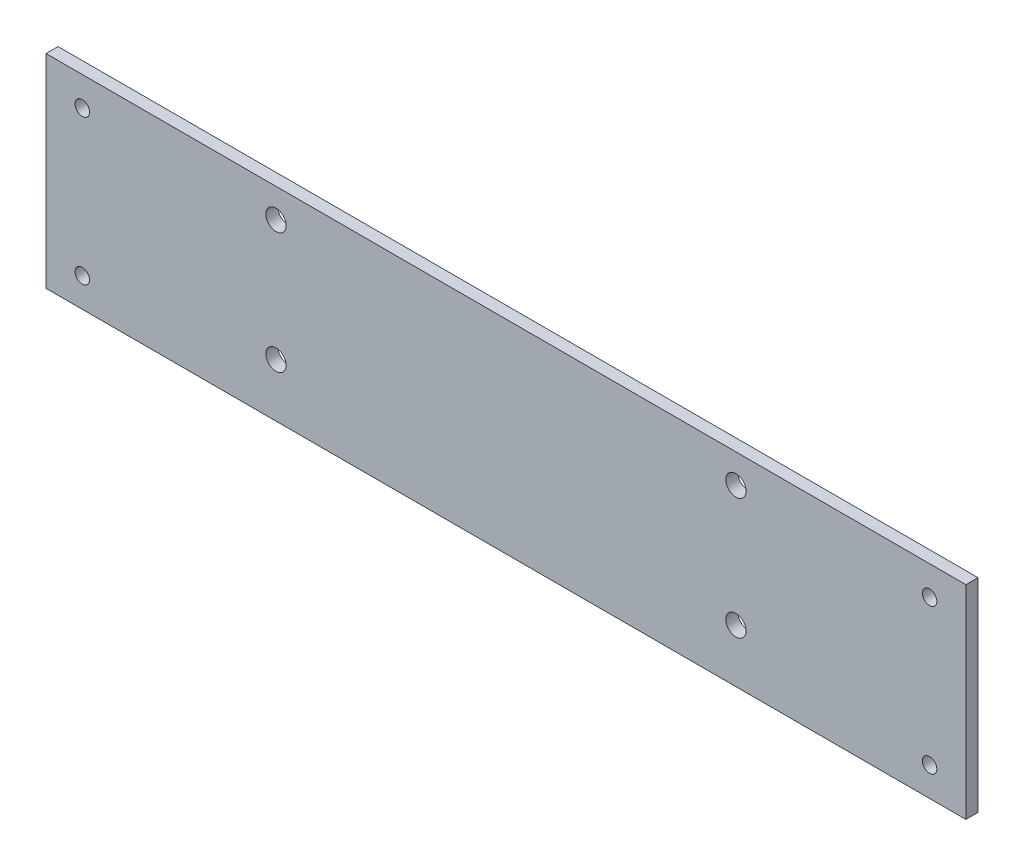
from build123d import *

# Parameters (mm, degrees)
SKETCH1_W           = 190
SKETCH1_H           = 50
BOSS_EXTRUDE1_DEPTH = 2.5
SKETCH2_R           = 1.5
CUT_EXTRUDE1_DEPTH  = 137.555862265
SKETCH3_R           = 2.1
CUT_EXTRUDE2_DEPTH  = 137.555862265
SKETCH_2_W          = 199.955047508
SKETCH_2_H          = 60.796168266
SKETCH_2_W_2        = 190
SKETCH_2_H_2        = 42
CUT_EXTRUDE_1_DEPTH = 10


with BuildPart() as part:
    # Sketch1 → Boss-Extrude1 (new body)
    with BuildSketch(Plane.XY):
        with Locations((-34.225888325, 19.067258883)):
            Rectangle(SKETCH1_W, SKETCH1_H)
    extrude(amount=BOSS_EXTRUDE1_DEPTH)

    # Sketch2 → Cut-Extrude1 (cut, through all)
    with BuildSketch(Plane.XY.offset(2.5)):
        with Locations((-121.725888325, 34.067258883)):
            Circle(SKETCH2_R)
        with Locations((-121.725888325, 4.067258883)):
            Circle(SKETCH2_R)
        with Locations((53.274111675, 34.067258883)):
            Circle(SKETCH2_R)
        with Locations((53.274111675, 4.067258883)):
            Circle(SKETCH2_R)
    extrude(amount=-CUT_EXTRUDE1_DEPTH, mode=Mode.SUBTRACT)

    # Sketch3 → Cut-Extrude2 (cut, through all)
    with BuildSketch(Plane.XY.offset(2.5)):
        with Locations((-81.725888325, 34.067258883)):
            Circle(SKETCH3_R)
        with Locations((13.274111675, 34.067258883)):
            Circle(SKETCH3_R)
        with Locations((13.274111675, 9.067258883)):
            Circle(SKETCH3_R)
        with Locations((-81.725888325, 9.067258883)):
            Circle(SKETCH3_R)
    extrude(amount=-CUT_EXTRUDE2_DEPTH, mode=Mode.SUBTRACT)

    # 草图2 → 切除-拉伸1 (cut)
    with BuildSketch(Plane.XY.offset(2.5)):
        with Locations((-32.748481011, 19.803493347)):
            Rectangle(SKETCH_2_W, SKETCH_2_H)
        with Locations((-34.225888325, 19.067258883)):
            Rectangle(SKETCH_2_W_2, SKETCH_2_H_2, mode=Mode.SUBTRACT)
    extrude(amount=-CUT_EXTRUDE_1_DEPTH, mode=Mode.SUBTRACT)


solid = part.part
